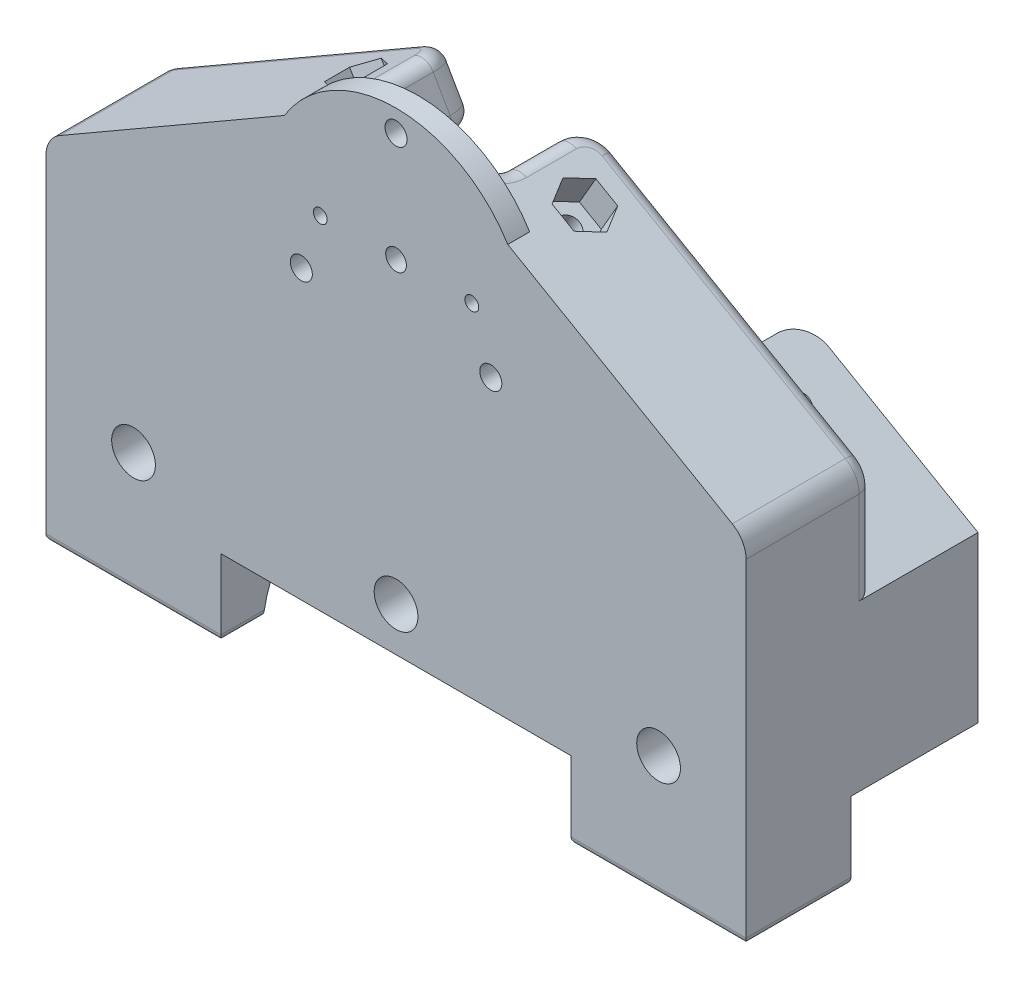
from build123d import *

# Parameters (mm, degrees)
BOSS_EXTRUDE1_DEPTH            = 15.24
SKETCH5_R                      = 1.5875
CUT_EXTRUDE2_DEPTH             = 8.89
SKETCH6_R                      = 1.5875
CUT_EXTRUDE3_DEPTH             = 8.89
BOSS_EXTRUDE4_DEPTH            = 15.24
SKETCH8_R                      = 1.5875
CUT_EXTRUDE4_DEPTH             = 12.7
SKETCH9_R                      = 1.5875
CUT_EXTRUDE5_DEPTH             = 12.7
CUT_EXTRUDE9_DEPTH             = 4.7625
CUT_EXTRUDE10_DEPTH            = 4.7625
CUT_EXTRUDE11_DEPTH            = 4.7625
CUT_EXTRUDE16_DEPTH            = 4.7625
SKETCH23_R                     = 1.5
BOSS_EXTRUDE5_DEPTH            = 3.175
M3_CLEARANCE_HOLE1_D           = 3.2
M3_CLEARANCE_HOLE1_DEPTH       = 9.906
M3_CLEARANCE_HOLE1_TIP         = 0.96137699
SKETCH27_R                     = 1
CUT_EXTRUDE18_DEPTH            = 128.18798457
SKETCH22_R                     = 3.175
CUT_EXTRUDE17_DEPTH            = 128.18798457
CBORE_FOR_M3_SHCS1_D           = 3.2
CBORE_FOR_M3_SHCS1_CBORE_D     = 6.5
CBORE_FOR_M3_SHCS1_CBORE_DEPTH = 3
SKETCH31_W                     = 25.4
SKETCH31_H                     = 15.24
BOSS_EXTRUDE7_DEPTH            = 11.2
FILLET5_R                      = 4
FILLET3_R                      = 3
FILLET6_R                      = 1
FILLET7_R                      = 2
SKETCH32_R                     = 4.7625
CUT_EXTRUDE19_DEPTH            = 90.424
SKETCH33_R                     = 4.7625
CUT_EXTRUDE20_DEPTH            = 90.424


with BuildPart() as part:
    # Sketch1 → Boss-Extrude1 (new body)
    with BuildSketch(Plane.XY):
        Polygon((0, 0), (101.6, 0), (101.6, 23.933700924), (76.481312339, 38.435982007), (72.036312339, 30.737016168), (92.27881813, 19.05), (9.32118187, 19.05), (29.563687661, 30.737016168), (25.118687661, 38.435982007), (0, 23.933700924), align=None)
    extrude(amount=BOSS_EXTRUDE1_DEPTH)

    # Sketch5 → Cut-Extrude2 (cut)
    with BuildSketch(Plane(origin=(35.763596504, 61.944366205, 0), x_dir=(0, 0, -1), z_dir=(0.4999999999999948, 0.8660254037844417, 0))):
        with Locations(Location((-7.62, -54.636768396, 0), (0, 0, 90))):
            Circle(SKETCH5_R)
    extrude(amount=-CUT_EXTRUDE2_DEPTH, mode=Mode.SUBTRACT)

    # Sketch6 → Cut-Extrude3 (cut)
    with BuildSketch(Plane(origin=(-10.363596504, 17.950275693, 0), x_dir=(0, 0, 1), z_dir=(-0.49999999999999467, 0.8660254037844417, 0))):
        with Locations(Location((7.62, 33.351412628, 0), (0, 0, 270))):
            Circle(SKETCH6_R)
    extrude(amount=-CUT_EXTRUDE3_DEPTH, mode=Mode.SUBTRACT)

    # Sketch7 → Boss-Extrude4 (add)
    with BuildSketch(Plane.XY.offset(15.24)):
        Polygon((0, 0), (101.6, 0), (101.6, 39.698250024), (60.815460508, 63.245214879), (56.370460508, 55.54624904), (69.568687661, 47.92624904), (78.862562339, 42.560427993), (76.481312339, 38.435982007), (76.481312339, 19.05), (25.118687661, 19.05), (25.118687661, 38.435982007), (22.737437661, 42.560427993), (32.031312339, 47.92624904), (45.229539492, 55.54624904), (40.784539492, 63.245214879), (0, 39.698250024), align=None)
    extrude(amount=BOSS_EXTRUDE4_DEPTH)

    # Sketch8 → Cut-Extrude4 (cut)
    with BuildSketch(Plane(origin=(-12.744846504, 22.074721679, 0), x_dir=(0, 0, -1), z_dir=(0.5000000000000002, -0.8660254037844386, 0))):
        with Locations(Location((-22.86, 59.323054722, 0), (0, 0, 90))):
            Circle(SKETCH8_R)
    extrude(amount=-CUT_EXTRUDE4_DEPTH, mode=Mode.SUBTRACT)

    # Sketch9 → Cut-Extrude5 (cut)
    with BuildSketch(Plane(origin=(38.144846504, 66.068812191, 0), x_dir=(0, 0, 1), z_dir=(-0.4999999999999995, -0.866025403784439, 0))):
        with Locations(Location((22.86, -28.665126303, 0), (0, 0, 270))):
            Circle(SKETCH9_R)
    extrude(amount=-CUT_EXTRUDE5_DEPTH, mode=Mode.SUBTRACT)

    # Sketch15 → Cut-Extrude9 (cut)
    with BuildSketch(Plane(origin=(42.589846504, 73.767778031, 0), x_dir=(0, 0, -1), z_dir=(0.5000000000000002, 0.8660254037844386, 0))):
        Polygon((-19.685, -26.832039198), (-19.685, -30.498213408), (-22.86, -32.331300512), (-26.035, -30.498213408), (-26.035, -26.832039198), (-22.86, -24.998952094), align=None)
    extrude(amount=-CUT_EXTRUDE9_DEPTH, mode=Mode.SUBTRACT)

    # Sketch16 → Cut-Extrude10 (cut)
    with BuildSketch(Plane(origin=(31.318596504, 54.245400366, 0), x_dir=(0, 0, -1), z_dir=(0.4999999999999952, 0.8660254037844415, 0))):
        Polygon((-4.445, -52.803681292), (-4.445, -56.469855501), (-7.62, -58.302942606), (-10.795, -56.469855501), (-10.795, -52.803681292), (-7.62, -50.970594187), align=None)
    extrude(amount=CUT_EXTRUDE10_DEPTH, mode=Mode.SUBTRACT)

    # Sketch17 → Cut-Extrude11 (cut)
    with BuildSketch(Plane(origin=(-5.918596504, 10.251309854, 18.861690464), x_dir=(-0.29619813272602846, -0.17101007166283452, 0.939692620785907), z_dir=(-0.4999999999999945, 0.8660254037844418, 0))):
        Polygon((-18.795588501, 29.32827886), (-18.795588501, 25.662104651), (-21.970588501, 23.829017546), (-25.145588501, 25.662104651), (-25.145588501, 29.32827886), (-21.970588501, 31.161365965), align=None)
    extrude(amount=CUT_EXTRUDE11_DEPTH, mode=Mode.SUBTRACT)

    # Sketch21 → Cut-Extrude16 (cut)
    with BuildSketch(Plane(origin=(-66.099801657, 1.535511744, 0), x_dir=(0.8660254037844384, 0.5000000000000004, 0), z_dir=(0.5000000000000004, -0.8660254037844384, 0))):
        Polygon((118.97440627, 24.693087105), (118.97440627, 21.026912895), (115.79940627, 19.193825791), (112.62440627, 21.026912895), (112.62440627, 24.693087105), (115.79940627, 26.526174209), align=None)
    extrude(amount=CUT_EXTRUDE16_DEPTH, mode=Mode.SUBTRACT)

    # Sketch23 → Boss-Extrude5 (add)
    with BuildSketch(Plane.XY.offset(30.48)):
        with BuildLine():
            Line((34.588310093, 59.667820167), (0, 39.698250024))
            Line((0, 39.698250024), (0, 0))
            Line((0, 0), (101.6, 0))
            Line((101.6, 0), (101.6, 39.698250024))
            Line((101.6, 39.698250024), (67.011689907, 59.667820167))
            ThreePointArc((67.011689907, 59.667820167), (50.8, 68.713640523), (34.588310093, 59.667820167))
        make_face()
        with Locations((50.8, 49.663640523)):
            Circle(SKETCH23_R, mode=Mode.SUBTRACT)
    extrude(amount=BOSS_EXTRUDE5_DEPTH)

    # M3 Clearance Hole1
    with Locations(Plane.XY.offset(33.655)):
        with Locations((37.051846715, 41.726140523), (64.548153285, 41.726140523), (50.8, 65.538640523)):
            Hole(M3_CLEARANCE_HOLE1_D / 2, depth=M3_CLEARANCE_HOLE1_DEPTH)
            with Locations((0, 0, -(M3_CLEARANCE_HOLE1_DEPTH + M3_CLEARANCE_HOLE1_TIP / 2))):  # 118° drill point
                Cone(0, M3_CLEARANCE_HOLE1_D / 2, M3_CLEARANCE_HOLE1_TIP, mode=Mode.SUBTRACT)

    # Sketch27 → Cut-Extrude18 (cut, through all)
    with BuildSketch(Plane.XY.offset(33.655)):
        with Locations((39.803062661, 49.663640523)):
            Circle(SKETCH27_R)
        with Locations((61.796937339, 49.663640523)):
            Circle(SKETCH27_R)
        with Locations((50.8, 49.663640523)):
            Circle(SKETCH27_R)
    extrude(amount=-CUT_EXTRUDE18_DEPTH, mode=Mode.SUBTRACT)

    # Sketch22 → Cut-Extrude17 (cut, through all)
    with BuildSketch(Plane(origin=(0, 0, 0), x_dir=(-1, 0, 0), z_dir=(0, 0, -1))):
        with Locations((-88.9, 6.35)):
            Circle(SKETCH22_R)
        with Locations((-50.8, 6.35)):
            Circle(SKETCH22_R)
        with Locations((-12.7, 6.35)):
            Circle(SKETCH22_R)
    extrude(amount=-CUT_EXTRUDE17_DEPTH, mode=Mode.SUBTRACT)

    # CBORE for M3 SHCS1 (through all)
    with Locations(Plane(origin=(2.230339258, 19.05, 8.392725324), x_dir=(1, 0, 0), z_dir=(0, 1, 0))):
        with Locations((64.444660742, 2.042725324), (32.694660742, 2.042725324)):
            CounterBoreHole(CBORE_FOR_M3_SHCS1_D / 2, CBORE_FOR_M3_SHCS1_CBORE_D / 2, CBORE_FOR_M3_SHCS1_CBORE_DEPTH)

    # Sketch31 → Boss-Extrude7 (add)
    with BuildSketch(Plane.XZ):
        with Locations((12.7, 26.035)):
            Rectangle(SKETCH31_W, SKETCH31_H)
        with Locations((88.9, 26.035)):
            Rectangle(SKETCH31_W, SKETCH31_H)
    extrude(amount=BOSS_EXTRUDE7_DEPTH)

    # Fillet5
    fillet5_edges = [part.edges().sort_by_distance(p)[0] for p in [
        (72.036312339, 30.737016168, 7.62),
        (74.258812339, 34.586499087, 0),
        (50.8, 19.05, 30.48),
        (25.118687661, 28.742991004, 30.48),
        (76.481312339, 28.742991004, 30.48),
        (25.118687661, 19.05, 22.86),
        (0, 39.698250024, 24.4475),
        (29.563687661, 30.737016168, 7.62),
        (27.341187661, 34.586499087, 0),
        (58.592960508, 59.395731959, 30.48),
        (43.007039492, 59.395731959, 30.48),
        (43.007039492, 59.395731959, 15.24),
        (58.592960508, 59.395731959, 15.24),
        (101.6, 39.698250024, 24.4475),
    ]]
    fillet(fillet5_edges, radius=FILLET5_R)

    # Fillet3
    fillet3_edges = [part.edges().sort_by_distance(p)[0] for p in [
        (25.118687661, 25.610347111, 15.24),
        (26.290260537, 20.221572875, 15.24),
        (76.481312339, 23.610347111, 15.24),
    ]]
    fillet(fillet3_edges, radius=FILLET3_R)

    # Fillet6
    fillet6_edges = [part.edges().sort_by_distance(p)[0] for p in [
        (88.9, -11.2, 18.415),
        (76.2, -11.2, 26.035),
        (88.9, -11.2, 33.655),
        (101.6, -11.2, 26.035),
        (12.7, -11.2, 33.655),
        (25.4, -11.2, 26.035),
        (12.7, -11.2, 18.415),
        (0, -11.2, 26.035),
    ]]
    fillet(fillet6_edges, radius=FILLET6_R)

    # Fillet7
    # the kernel refuses this fillet: 2 mm, written as the material it takes off along each edge
    with BuildSketch(Plane(origin=(56.370460508, 55.54624904, 19.24), x_dir=(0.49999999999999784, 0.8660254037844399, 0), z_dir=(0, 0, 1)), Plane(origin=(60.815460508, 63.245214879, 19.24), x_dir=(0.8660254037844384, -0.5000000000000006, 0), z_dir=(0, 0, 1)), Plane(origin=(45.229539492, 55.54624904, 19.24), x_dir=(-0.8660254037844329, -0.5000000000000101, 0), z_dir=(0, 0, 1))) as fillet7_piece_1:
        with BuildLine():
            CenterArc((FILLET7_R, -FILLET7_R), FILLET7_R, 90, 90)
            Line((0, -FILLET7_R), (0, 0))
            Line((0, 0), (FILLET7_R, 0))
        make_face()
    extrude(amount=7.24, mode=Mode.SUBTRACT)
    with BuildSketch(Plane(origin=(40.784539492, 63.245214879, 19.24), x_dir=(-0.8660254037844384, -0.5000000000000006, 0), z_dir=(0, 0, 1))) as fillet7_piece_2:
        with BuildLine():
            CenterArc((FILLET7_R, FILLET7_R), FILLET7_R, 180, 90)
            Line((0, FILLET7_R), (0, 0))
            Line((0, 0), (FILLET7_R, 0))
        make_face()
    extrude(amount=7.24, mode=Mode.SUBTRACT)
    with BuildSketch(Plane(origin=(52.906358893, 57.54624904, 26.48), x_dir=(0.8660254037844389, -0.4999999999999998, 0), z_dir=(0, 0, -1))) as fillet7_piece_3_section:
        with BuildLine():
            CenterArc((4 + FILLET7_R, -FILLET7_R), FILLET7_R, 90, 90)
            Line((4 + FILLET7_R, 0), (4, 0))
            Line((4, 0), (4, -FILLET7_R))
        make_face()
    fillet7_piece_3 = revolve(axis=Axis((52.906358893, 57.54624904, 26.48), (-0.4999999999999996, -0.8660254037844388, 0)), revolution_arc=161.648494619, mode=Mode.PRIVATE)
    fillet7_piece_3 = split(fillet7_piece_3, bisect_by=Plane(origin=(55.711108259, 56.555431682, 30.48), z_dir=(0, 0, -1)), keep=Keep.TOP, mode=Mode.PRIVATE)
    add(fillet7_piece_3, mode=Mode.SUBTRACT)
    with BuildSketch(Plane(origin=(59.834562123, 53.54624904, 15.24), x_dir=(0.5000000000000014, 0.8660254037844379, 0), z_dir=(0.8660254037844378, -0.5000000000000014, 0)), Plane(origin=(22.737437661, 42.560427993, 15.24), x_dir=(-0.49999999999999967, 0.8660254037844389, 0), z_dir=(0.8660254037844388, 0.4999999999999996, 0))) as fillet7_piece_4:
        with BuildLine():
            CenterArc((FILLET7_R, FILLET7_R), FILLET7_R, 180, 90)
            Line((0, FILLET7_R), (0, 0))
            Line((0, 0), (FILLET7_R, 0))
        make_face()
    extrude(amount=21.971642094, mode=Mode.SUBTRACT)
    with BuildSketch(Plane(origin=(59.834562123, 53.54624904, 19.24), x_dir=(0, 0, -1), z_dir=(0.8660254037844388, -0.4999999999999996, 0))) as fillet7_piece_5:
        with BuildLine():
            CenterArc((4 - FILLET7_R, FILLET7_R), FILLET7_R, 270, 90)
            Line((4 - FILLET7_R, 0), (4, 0))
            Line((4, 0), (4, FILLET7_R))
        make_face()
    revolve(axis=Axis((59.834562123, 53.54624904, 19.24), (0.4999999999999996, 0.8660254037844388, 0)), revolution_arc=90, mode=Mode.SUBTRACT)
    with BuildSketch(Plane(origin=(101.6, 18.933700924, 15.24), x_dir=(0, 0, 1), z_dir=(0, 1, 0))) as fillet7_piece_6_section:
        with BuildLine():
            CenterArc((FILLET7_R, -FILLET7_R), FILLET7_R, 90, 90)
            Line((0, -FILLET7_R), (0, 0))
            Line((0, 0), (FILLET7_R, 0))
        make_face()
    fillet7_piece_6 = extrude(amount=18.455148023, mode=Mode.PRIVATE)
    fillet7_piece_6 = split(fillet7_piece_6, bisect_by=Plane(origin=(98.663610149, 25.629026395, 15.705991529), z_dir=(0.4999999999999953, 0.8660254037844414, 0)), keep=Keep.TOP, mode=Mode.PRIVATE)
    add(fillet7_piece_6, mode=Mode.SUBTRACT)
    with BuildSketch(Plane(origin=(97.6, 37.388848948, 15.24), x_dir=(0.5000000000000006, 0.8660254037844384, 0), z_dir=(-0.8660254037844384, 0.5000000000000006, -1.2443164570229456e-14))) as fillet7_piece_7:
        with BuildLine():
            CenterArc((4 - FILLET7_R, -FILLET7_R), FILLET7_R, 0, 90)
            Line((4 - FILLET7_R, 0), (4, 0))
            Line((4, 0), (4, -FILLET7_R))
        make_face()
    revolve(axis=Axis((97.6, 37.388848948, 15.24), (0, 0, -1)), revolution_arc=60, mode=Mode.SUBTRACT)
    with BuildSketch(Plane(origin=(99.6, 40.852950563, 15.24), x_dir=(0, 0, 1), z_dir=(-0.8660254037844386, 0.5000000000000003, 0))) as fillet7_piece_8:
        with BuildLine():
            CenterArc((FILLET7_R, -FILLET7_R), FILLET7_R, 90, 90)
            Line((0, -FILLET7_R), (0, 0))
            Line((0, 0), (FILLET7_R, 0))
        make_face()
    extrude(amount=40.784528633, mode=Mode.SUBTRACT)
    with BuildSketch(Plane(origin=(64.279562123, 61.245214879, 19.24), x_dir=(0, 0, -1), z_dir=(0.8660254037844388, -0.4999999999999996, 0))) as fillet7_piece_9:
        with BuildLine():
            CenterArc((4 - FILLET7_R, -FILLET7_R), FILLET7_R, 0, 90)
            Line((4, -FILLET7_R), (4, 0))
            Line((4, 0), (4 - FILLET7_R, 0))
        make_face()
    revolve(axis=Axis((64.279562123, 61.245214879, 19.24), (0.4999999999999996, 0.8660254037844388, 0)), revolution_arc=90, mode=Mode.SUBTRACT)
    with BuildSketch(Plane(origin=(57.351358893, 65.245214879, 26.48), x_dir=(0.8660254037844389, -0.4999999999999998, 0), z_dir=(0, 0, -1))) as fillet7_piece_10_section:
        with BuildLine():
            CenterArc((4 + FILLET7_R, FILLET7_R), FILLET7_R, 180, 90)
            Line((4, FILLET7_R), (4, 0))
            Line((4, 0), (4 + FILLET7_R, 0))
        make_face()
    fillet7_piece_10 = revolve(axis=Axis((57.351358893, 65.245214879, 26.48), (-0.4999999999999996, -0.8660254037844388, 0)), revolution_arc=161.648494619, mode=Mode.PRIVATE)
    fillet7_piece_10 = split(fillet7_piece_10, bisect_by=Plane(origin=(61.020194751, 62.751413632, 30.48), z_dir=(0, 0, -1)), keep=Keep.TOP, mode=Mode.PRIVATE)
    add(fillet7_piece_10, mode=Mode.SUBTRACT)
    with BuildSketch(Plane(origin=(44.248641107, 65.245214879, 26.48), x_dir=(-0.8660254037844389, -0.4999999999999998, 0), z_dir=(0, 0, -1))) as fillet7_piece_11_section:
        with BuildLine():
            CenterArc((4 + FILLET7_R, -FILLET7_R), FILLET7_R, 90, 90)
            Line((4, -FILLET7_R), (4, 0))
            Line((4, 0), (4 + FILLET7_R, 0))
        make_face()
    fillet7_piece_11 = revolve(axis=Axis((44.248641107, 65.245214879, 26.48), (-0.5000000000000003, 0.8660254037844386, 0)), revolution_arc=161.648494619, mode=Mode.PRIVATE)
    fillet7_piece_11 = split(fillet7_piece_11, bisect_by=Plane(origin=(40.579805247, 62.751413633, 30.48), z_dir=(0, 0, -1)), keep=Keep.TOP, mode=Mode.PRIVATE)
    add(fillet7_piece_11, mode=Mode.SUBTRACT)
    with BuildSketch(Plane(origin=(0, 37.388848948, 15.24), x_dir=(0, 0, 1), z_dir=(0, -1, 0))) as fillet7_piece_12_section:
        with BuildLine():
            CenterArc((FILLET7_R, -FILLET7_R), FILLET7_R, 90, 90)
            Line((0, -FILLET7_R), (0, 0))
            Line((0, 0), (FILLET7_R, 0))
        make_face()
    fillet7_piece_12 = extrude(amount=18.455148023, mode=Mode.PRIVATE)
    fillet7_piece_12 = split(fillet7_piece_12, bisect_by=Plane(origin=(2.936388551, 25.629025645, 15.705991741), z_dir=(-0.4999999999999949, 0.8660254037844416, 0)), keep=Keep.TOP, mode=Mode.PRIVATE)
    add(fillet7_piece_12, mode=Mode.SUBTRACT)
    with BuildSketch(Plane(origin=(4, 37.388848948, 15.24), x_dir=(-0.4999999999999999, 0.8660254037844387, -1.332267629550187e-15), z_dir=(0.8660254037844387, 0.4999999999999999, 0))) as fillet7_piece_13:
        with BuildLine():
            CenterArc((4 - FILLET7_R, FILLET7_R), FILLET7_R, 270, 90)
            Line((4 - FILLET7_R, 0), (4, 0))
            Line((4, 0), (4, FILLET7_R))
        make_face()
    revolve(axis=Axis((4, 37.388848948, 15.24), (0, 0, 1)), revolution_arc=60, mode=Mode.SUBTRACT)
    with BuildSketch(Plane(origin=(37.320437877, 61.245214879, 15.24), x_dir=(0.5000000000000006, -0.8660254037844385, 0), z_dir=(-0.8660254037844384, -0.5000000000000004, 0))) as fillet7_piece_14:
        with BuildLine():
            CenterArc((FILLET7_R, FILLET7_R), FILLET7_R, 180, 90)
            Line((0, FILLET7_R), (0, 0))
            Line((0, 0), (FILLET7_R, 0))
        make_face()
    extrude(amount=40.784528633, mode=Mode.SUBTRACT)
    with BuildSketch(Plane(origin=(37.320437877, 61.245214879, 19.24), x_dir=(0, 0, -1), z_dir=(-0.8660254037844386, -0.5000000000000003, 0))) as fillet7_piece_15:
        with BuildLine():
            CenterArc((4 - FILLET7_R, FILLET7_R), FILLET7_R, 270, 90)
            Line((4, FILLET7_R), (4, 0))
            Line((4, 0), (4 - FILLET7_R, 0))
        make_face()
    revolve(axis=Axis((37.320437877, 61.245214879, 19.24), (0.5000000000000003, -0.8660254037844386, 0)), revolution_arc=90, mode=Mode.SUBTRACT)
    with BuildSketch(Plane(origin=(48.693641107, 57.54624904, 26.48), x_dir=(-0.8660254037844389, -0.4999999999999998, 0), z_dir=(0, 0, -1))) as fillet7_piece_16_section:
        with BuildLine():
            CenterArc((4 + FILLET7_R, FILLET7_R), FILLET7_R, 180, 90)
            Line((4, FILLET7_R), (4, 0))
            Line((4, 0), (4 + FILLET7_R, 0))
        make_face()
    fillet7_piece_16 = revolve(axis=Axis((48.693641107, 57.54624904, 26.48), (-0.5000000000000003, 0.8660254037844386, 0)), revolution_arc=161.648494619, mode=Mode.PRIVATE)
    fillet7_piece_16 = split(fillet7_piece_16, bisect_by=Plane(origin=(44.699527946, 55.615844594, 30.48), z_dir=(0, 0, -1)), keep=Keep.TOP, mode=Mode.PRIVATE)
    add(fillet7_piece_16, mode=Mode.SUBTRACT)
    with BuildSketch(Plane(origin=(41.765437877, 53.54624904, 19.24), x_dir=(0, 0, -1), z_dir=(-0.8660254037844386, -0.5000000000000003, 0))) as fillet7_piece_17:
        with BuildLine():
            CenterArc((4 - FILLET7_R, -FILLET7_R), FILLET7_R, 0, 90)
            Line((4 - FILLET7_R, 0), (4, 0))
            Line((4, 0), (4, -FILLET7_R))
        make_face()
    revolve(axis=Axis((41.765437877, 53.54624904, 19.24), (0.5000000000000003, -0.8660254037844386, 0)), revolution_arc=90, mode=Mode.SUBTRACT)

    # Sketch32 → Cut-Extrude19 (cut)
    with BuildSketch(Plane(origin=(-12.744846504, 22.074721679, 0), x_dir=(0.8660254037844386, 0.5000000000000001, 0), z_dir=(0.5000000000000001, -0.8660254037844386, 0))):
        with Locations(Location((59.323054722, 22.86, 0), (0, 0, 180))):
            Circle(SKETCH32_R)
    extrude(amount=CUT_EXTRUDE19_DEPTH, mode=Mode.SUBTRACT)

    # Sketch33 → Cut-Extrude20 (cut)
    with BuildSketch(Plane(origin=(38.144846504, 66.068812191, 0), x_dir=(0.866025403784439, -0.4999999999999994, 0), z_dir=(-0.4999999999999994, -0.866025403784439, 0))):
        with Locations(Location((28.665126303, 22.86, 0), (0, 0, 130.526545826))):
            Circle(SKETCH33_R)
    extrude(amount=CUT_EXTRUDE20_DEPTH, mode=Mode.SUBTRACT)


solid = part.part
